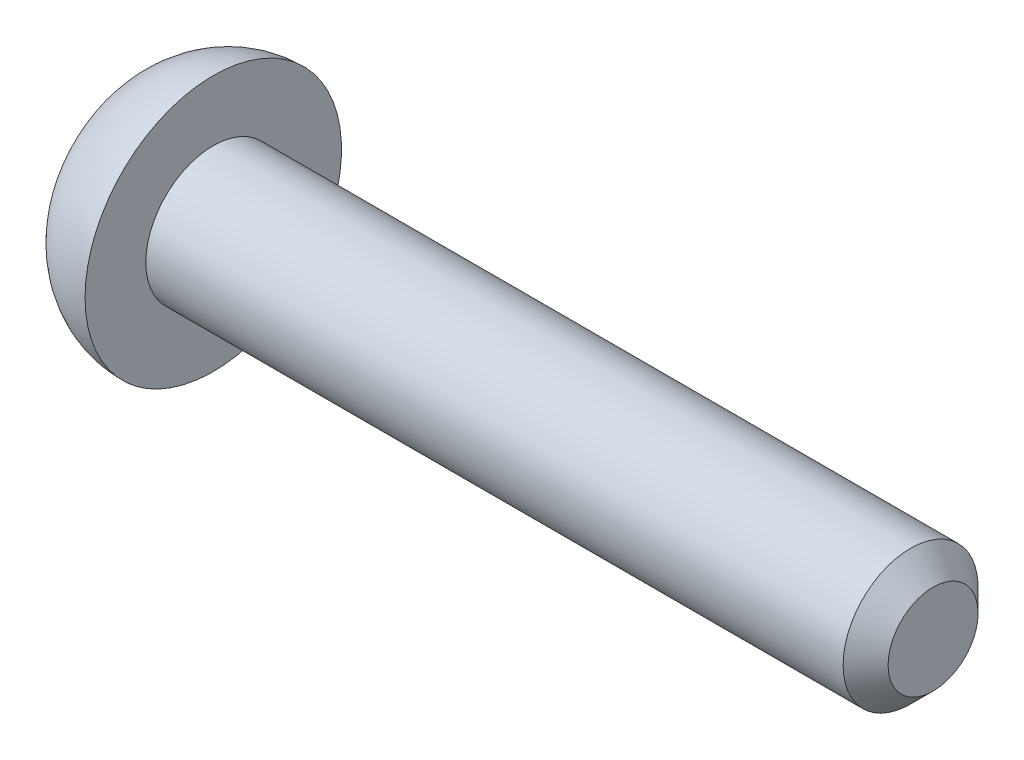
from build123d import *

# Parameters (mm, degrees)
CHAMFER1_SIZE      = 0.5
CUT_EXTRUDE1_DEPTH = 1


with BuildPart() as part:
    # Sketch2 → Revolve1 (revolve)
    with BuildSketch(Plane(origin=(0, 0, 0), x_dir=(1, 0, 0), z_dir=(0, 1, 0))):
        with BuildLine():
            Line((0, 0), (0, 1.5))
            Line((0, 1.5), (-16, 1.5))
            Line((-16, 1.5), (-16, 2.85))
            ThreePointArc((-16, 2.85), (-16.917065968, 2.639177072), (-17.65, 2.049038106))
            Line((-17.65, 2.049038106), (-17.65, 0))
            Line((-17.65, 0), (0, 0))
        make_face()
    revolve(axis=Axis((-17.65, 0, 0), (1, 0, 0)))

    # Chamfer1
    chamfer1_edges = [part.edges().sort_by_distance(p)[0] for p in [
        (0, 0, 1.5),
    ]]
    chamfer(chamfer1_edges, length=CHAMFER1_SIZE)

    # Sketch4 → Cut-Extrude1 (cut)
    with BuildSketch(Plane.ZY.offset(17.65)):
        with BuildLine():
            ThreePointArc((-1.342027284, 0.090739778), (-0.883315009, 0.509982158), (-0.749596595, 1.116859832))
            ThreePointArc((-0.749596595, 1.116859832), (-0.7, 1.212435565), (-0.592430689, 1.20759961))
            ThreePointArc((-0.592430689, 1.20759961), (0, 1.019964317), (0.592430689, 1.20759961))
            ThreePointArc((0.592430689, 1.20759961), (0.7, 1.212435565), (0.749596595, 1.116859832))
            ThreePointArc((0.749596595, 1.116859832), (0.883315009, 0.509982158), (1.342027284, 0.090739778))
            ThreePointArc((1.342027284, 0.090739778), (1.4, 0), (1.342027284, -0.090739778))
            ThreePointArc((1.342027284, -0.090739778), (0.883315009, -0.509982158), (0.749596595, -1.116859832))
            ThreePointArc((0.749596595, -1.116859832), (0.7, -1.212435565), (0.592430689, -1.20759961))
            ThreePointArc((0.592430689, -1.20759961), (0, -1.019964317), (-0.592430689, -1.20759961))
            ThreePointArc((-0.592430689, -1.20759961), (-0.7, -1.212435565), (-0.749596595, -1.116859832))
            ThreePointArc((-0.749596595, -1.116859832), (-0.883315009, -0.509982158), (-1.342027284, -0.090739778))
            ThreePointArc((-1.342027284, -0.090739778), (-1.4, 0), (-1.342027284, 0.090739778))
        make_face()
    extrude(amount=-CUT_EXTRUDE1_DEPTH, mode=Mode.SUBTRACT)


solid = part.part
